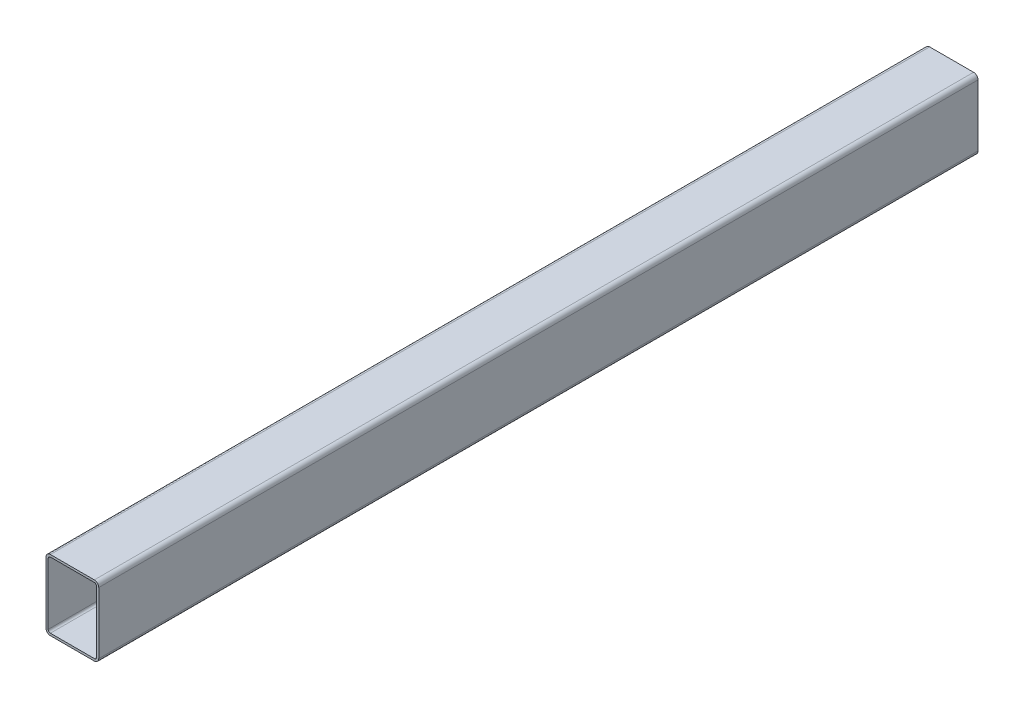
from build123d import *

# Parameters (mm, degrees)
BOSS_EXTRUDE1_DEPTH = 635


with BuildPart() as part:
    # Sketch4 → Boss-Extrude1 (new, symmetric)
    with BuildSketch(Plane.XY):
        with BuildLine():
            Line((31.75, -50.865662775), (-31.75, -50.865662775))
            ThreePointArc((-31.75, -50.865662775), (-36.240128061, -49.005790836), (-38.1, -44.515662775))
            Line((-38.1, -44.515662775), (-38.1, 44.384337225))
            ThreePointArc((-38.1, 44.384337225), (-36.240128061, 48.874465286), (-31.75, 50.734337225))
            Line((-31.75, 50.734337225), (31.75, 50.734337225))
            ThreePointArc((31.75, 50.734337225), (36.240128061, 48.874465286), (38.1, 44.384337225))
            Line((38.1, 44.384337225), (38.1, -44.515662775))
            ThreePointArc((38.1, -44.515662775), (36.240128061, -49.005790836), (31.75, -50.865662775))
        make_face()
        with BuildLine():
            Line((31.75, -47.690662775), (-31.75, -47.690662775))
            ThreePointArc((-31.75, -47.690662775), (-33.99506403, -46.760726805), (-34.925, -44.515662775))
            Line((-34.925, -44.515662775), (-34.925, 44.384337225))
            ThreePointArc((-34.925, 44.384337225), (-33.99506403, 46.629401255), (-31.75, 47.559337225))
            Line((-31.75, 47.559337225), (31.75, 47.559337225))
            ThreePointArc((31.75, 47.559337225), (33.99506403, 46.629401255), (34.925, 44.384337225))
            Line((34.925, 44.384337225), (34.925, -44.515662775))
            ThreePointArc((34.925, -44.515662775), (33.99506403, -46.760726805), (31.75, -47.690662775))
        make_face(mode=Mode.SUBTRACT)
    extrude(amount=BOSS_EXTRUDE1_DEPTH, both=True)


solid = part.part
